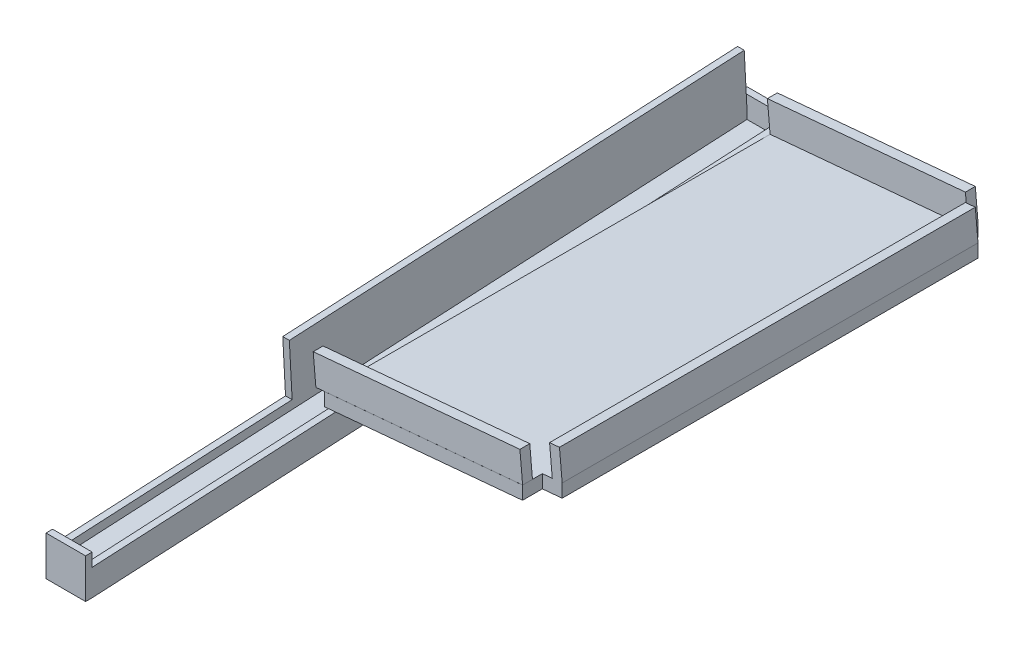
from build123d import *

# Parameters (mm, degrees)
BOSS_EXTRUDE1_DEPTH  = 690
SKETCH3_W            = 30
SKETCH3_H            = 30
CUT_EXTRUDE2_DEPTH   = 767.485485838
BOSS_EXTRUDE2_DEPTH  = 60
SKETCH6_W            = 40
SKETCH6_H            = 1043.42998453
CUT_EXTRUDE3_DEPTH   = 13
SKETCH7_W            = 40
SKETCH7_H            = 13
CUT_EXTRUDE4_DEPTH   = 1098.004231757
SKETCH10_W           = 60
SKETCH10_H           = 60
BOSS_EXTRUDE4_DEPTH  = 10
BOSS_EXTRUDE8_DEPTH  = 30
SKETCH17_W           = 301.23711865
SKETCH17_H           = 15
SKETCH17_W_2         = 15.061855932
SKETCH17_H_2         = 630
SKETCH17_W_3         = 314.469649215
SKETCH17_H_3         = 14.937214588
BOSS_EXTRUDE9_DEPTH  = 45
SKETCH8_W            = 10
SKETCH8_H            = 690.069913578
BOSS_EXTRUDE10_DEPTH = 80
SKETCH21_W           = 60
SKETCH21_H           = 60
BOSS_EXTRUDE14_DEPTH = 10


with BuildPart() as part:
    # Sketch1 → Boss-Extrude1 (new body)
    with BuildSketch(Plane.XY):
        Polygon((0, 20), (0, 0), (330, 30), (330, 50), align=None)
    extrude(amount=BOSS_EXTRUDE1_DEPTH)

    # Sketch3 → Cut-Extrude2 (cut, through all)
    with BuildSketch(Plane(origin=(0, 0, 0), x_dir=(1, 0, 0), z_dir=(0, 1, 0))):
        with Locations((315, -675)):
            Rectangle(SKETCH3_W, SKETCH3_H)
        with Locations((315, -15)):
            Rectangle(SKETCH3_W, SKETCH3_H)
    extrude(amount=CUT_EXTRUDE2_DEPTH, mode=Mode.SUBTRACT)

    # Sketch4 → Boss-Extrude2 (add)
    with BuildSketch(Plane.ZY):
        Polygon((0, 20), (0, 0), (0, -20), (1042, -74.608906013), (1042, -54.608906013), (1042, -34.608906013), align=None)
    extrude(amount=BOSS_EXTRUDE2_DEPTH)

    # Sketch6 → Cut-Extrude3 (cut)
    with BuildSketch(Plane(origin=(0, 19.945218954, 1.045284633), x_dir=(1, 0, 0), z_dir=(0, 0.9986295347545742, 0.05233595624294041))):
        with Locations((-30, -520.66827314)):
            Rectangle(SKETCH6_W, SKETCH6_H)
    extrude(amount=-CUT_EXTRUDE3_DEPTH, mode=Mode.SUBTRACT)

    # Sketch7 → Cut-Extrude4 (cut, through all)
    with BuildSketch(Plane(origin=(0, -54.554124967, 1040.954715367), x_dir=(-1, 0, 0), z_dir=(0, 0.05233595624294042, -0.9986295347545742))):
        with Locations((30, 13.472590695)):
            Rectangle(SKETCH7_W, SKETCH7_H)
    extrude(amount=-CUT_EXTRUDE4_DEPTH, mode=Mode.SUBTRACT)

    # Sketch10 → Boss-Extrude4 (add)
    with BuildSketch(Plane.XY.offset(1042)):
        with Locations((-30, -44.608906013)):
            Rectangle(SKETCH10_W, SKETCH10_H)
    extrude(amount=BOSS_EXTRUDE4_DEPTH)

    # Sketch16 → Boss-Extrude8 (add)
    with BuildSketch(Plane.ZY.offset(60)):
        Polygon((0, -20), (0, -80), (30, -80), (30, -21.572233378), align=None)
        Polygon((521, -47.304453006), (521, -80), (551, -80), (551, -48.876686385), align=None)
    extrude(amount=-BOSS_EXTRUDE8_DEPTH)

    # Sketch17 → Boss-Extrude9 (add)
    with BuildSketch(Plane(origin=(-1.803278689, 19.836065574, 0), x_dir=(0.9958932064677039, 0.09053574604251852, 0), z_dir=(-0.09053574604251852, 0.9958932064677039, 0))):
        with Locations((152.429274246, -7.5)):
            Rectangle(SKETCH17_W, SKETCH17_H)
        with Locations((325.64061747, -345)):
            Rectangle(SKETCH17_W_2, SKETCH17_H_2)
        with Locations((145.813008964, -682.468607294)):
            Rectangle(SKETCH17_W_3, SKETCH17_H_3)
    extrude(amount=BOSS_EXTRUDE9_DEPTH)

    # Sketch8 → Boss-Extrude10 (add)
    with BuildSketch(Plane(origin=(0, 19.945218954, 1.045284633), x_dir=(1, 0, 0), z_dir=(0, 0.9986295347545742, 0.05233595624294041))):
        with Locations((-55, -343.988237664)):
            Rectangle(SKETCH8_W, SKETCH8_H)
    extrude(amount=BOSS_EXTRUDE10_DEPTH)


with BuildPart() as body_2:
    # Sketch21 → Boss-Extrude14 (new body)
    with BuildSketch(Plane(origin=(0, 0, 0), x_dir=(-1, 0, 0), z_dir=(0, 0, -1))):
        with Locations((30, 10)):
            Rectangle(SKETCH21_W, SKETCH21_H)
    extrude(amount=BOSS_EXTRUDE14_DEPTH)


solid = Compound([part.part, body_2.part])
